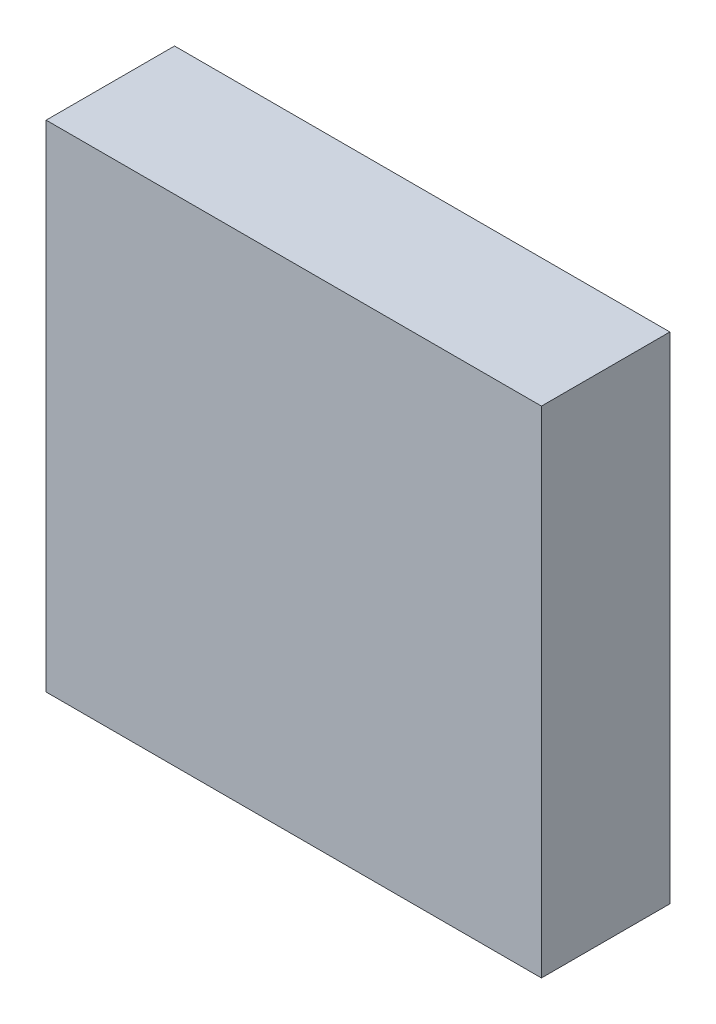
from build123d import *

# Parameters (mm, degrees)
SKIZZE1_W                       = 135
SKIZZE1_H                       = 135
SKIZZE1_W_2                     = 131
SKIZZE1_H_2                     = 131
AUFSATZ_LINEAR_AUSTRAGEN1_DEPTH = 30
SKIZZE2_W                       = 135
SKIZZE2_H                       = 135
AUFSATZ_LINEAR_AUSTRAGEN2_DEPTH = 5


with BuildPart() as part:
    # Skizze1 → Aufsatz-Linear austragen1 (new body)
    with BuildSketch(Plane.XY):
        Rectangle(SKIZZE1_W, SKIZZE1_H)
        Rectangle(SKIZZE1_W_2, SKIZZE1_H_2, mode=Mode.SUBTRACT)
    extrude(amount=AUFSATZ_LINEAR_AUSTRAGEN1_DEPTH)

    # Skizze2 → Aufsatz-Linear austragen2 (add)
    with BuildSketch(Plane.XY.offset(30)):
        Rectangle(SKIZZE2_W, SKIZZE2_H)
    extrude(amount=AUFSATZ_LINEAR_AUSTRAGEN2_DEPTH)


solid = part.part
